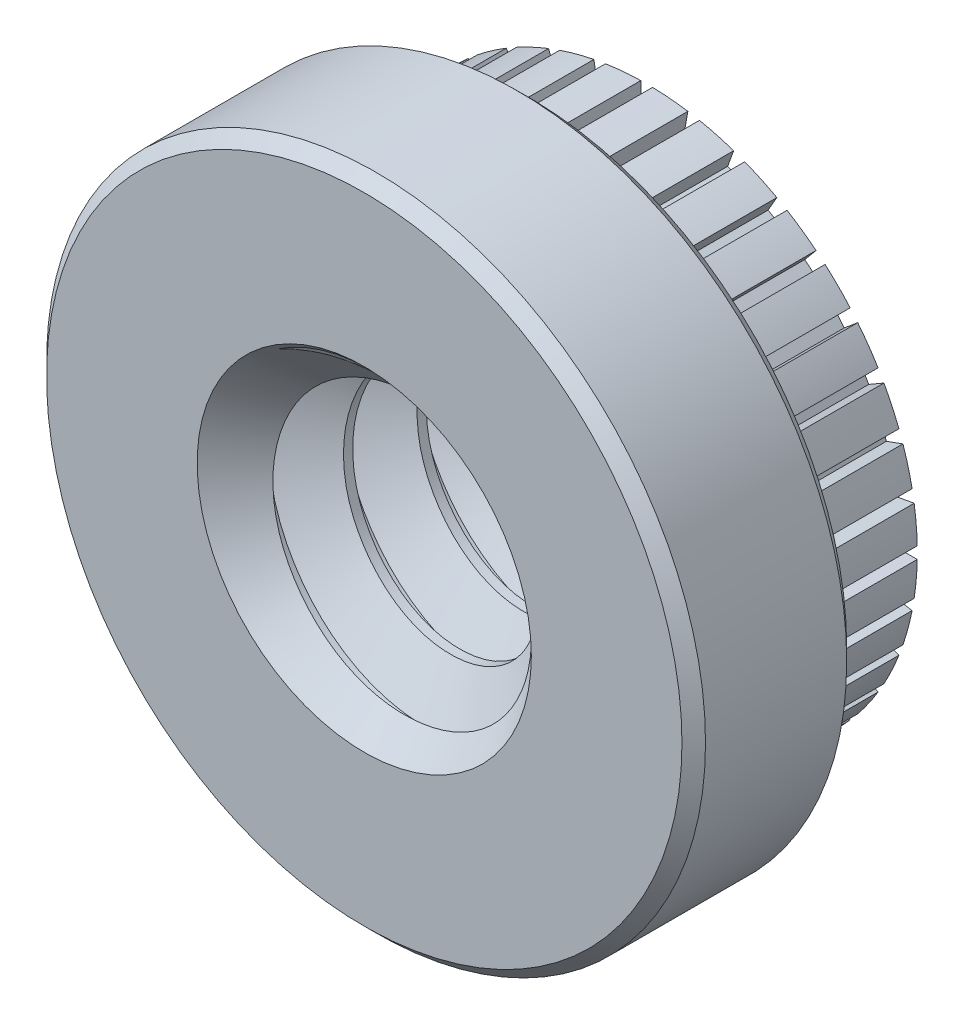
from build123d import *

# Parameters (mm, degrees)
SKETCH1_R               = 3.556
EXTRUDE1_DEPTH          = 1.778
SKETCH2_R               = 2.921
EXTRUDE2_DEPTH          = 1.524
SKETCH3_W               = 0.127
SKETCH3_H               = 0.8255
CUT_EXTRUDE_THIN1_DEPTH = 1.524
CIRPATTERN1_COUNT       = 36
SKETCH5_OUTSIDE_W       = 11.23
SKETCH5_OUTSIDE_H       = 11.23
SKETCH5_OUTSIDE_R       = 2.4765
CUT_EXTRUDE1_DEPTH      = 0.254
CHAMFER1_SIZE           = 0.127
SKETCH6_R               = 3.556
SKETCH6_R_2             = 2.4765
CUT_EXTRUDE2_DEPTH      = 0.127
CHAMFER2_SIZE           = 0.127
SKETCH7_R               = 1.7526
CUT_EXTRUDE3_DEPTH      = 7.016101395
SWEEP1_PITCH            = 0.79375
SKETCH10_R              = 3.429
CUT_EXTRUDE4_DEPTH      = 7.423699814
SKETCH11_R              = 2.3495
CUT_EXTRUDE5_DEPTH      = 7.01610145


with BuildPart() as part:
    # Sketch1 → Extrude1 (new body)
    with BuildSketch(Plane.XY):
        Circle(SKETCH1_R)
    extrude(amount=-EXTRUDE1_DEPTH)

    # Sketch2 → Extrude2 (add)
    with BuildSketch(Plane(origin=(0, 0, -1.778), x_dir=(-1, 0, 0), z_dir=(0, 0, -1))):
        with Locations(Location((0, 0, 0), (0, 0, 180))):
            Circle(SKETCH2_R)
    extrude(amount=EXTRUDE2_DEPTH)

    # Sketch3 → Cut-Extrude-Thin1 (cut)
    with BuildSketch(Plane(origin=(0, 0, -3.302), x_dir=(-1, 0, 0), z_dir=(0, 0, -1))):
        with Locations((0, 3.14325)):
            Rectangle(SKETCH3_W, SKETCH3_H)
    cut_extrude_thin1 = extrude(amount=-CUT_EXTRUDE_THIN1_DEPTH, mode=Mode.SUBTRACT)

    # CirPattern1: Cut-Extrude-Thin1 ×36 about axis
    cirpattern1_axis = Axis((0, 0, 0), (0, 0, 1))
    for i in range(1, CIRPATTERN1_COUNT):
        add(cut_extrude_thin1.rotate(cirpattern1_axis, i * 360 / CIRPATTERN1_COUNT), mode=Mode.SUBTRACT)

    # Sketch5 outside → Cut-Extrude1 (cut)
    with BuildSketch(Plane(origin=(0, 0, -3.302), x_dir=(-1, 0, 0), z_dir=(0, 0, -1))):
        Rectangle(SKETCH5_OUTSIDE_W, SKETCH5_OUTSIDE_H)
        Circle(SKETCH5_OUTSIDE_R, mode=Mode.SUBTRACT)
    extrude(amount=-CUT_EXTRUDE1_DEPTH, mode=Mode.SUBTRACT)

    # Chamfer1
    chamfer1_edges = [part.edges().sort_by_distance(p)[0] for p in [
        (2.4765, 0, -3.302),
    ]]
    chamfer(chamfer1_edges, length=CHAMFER1_SIZE)

    # Sketch6 → Cut-Extrude2 (cut)
    with BuildSketch(Plane(origin=(0, 0, -1.778), x_dir=(-1, 0, 0), z_dir=(0, 0, -1))):
        with Locations(Location((0, 0, 0), (0, 0, 180))):
            Circle(SKETCH6_R)
        Circle(SKETCH6_R_2, mode=Mode.SUBTRACT)
    extrude(amount=CUT_EXTRUDE2_DEPTH, mode=Mode.SUBTRACT)

    # Chamfer2
    chamfer2_edges = [part.edges().sort_by_distance(p)[0] for p in [
        (-3.556, 0, 0),
        (-3.556, 0, -1.778),
    ]]
    chamfer(chamfer2_edges, length=CHAMFER2_SIZE)

    # Sketch7 → Cut-Extrude3 (cut, through all)
    with BuildSketch(Plane.XY):
        Circle(SKETCH7_R)
    extrude(amount=-CUT_EXTRUDE3_DEPTH, mode=Mode.SUBTRACT)

    # Sweep1: the profile of Sketch9 profile screwed along a right-hand helix of 6.24 turns, 6 arcs to a turn; built about Z, then put on its axis
    sweep1_z = Axis((0, 0, 0), (0, 0, 1))
    sweep1_corners = [(1.7529, 0, -0.694704455), (1.237044252, 0, -0.396875), (1.237044252, 0, -0.29765625), (1.7529, 0, 0.000173205)]
    with BuildLine(mode=Mode.PRIVATE) as sweep1_profile:
        Line(sweep1_corners[0], sweep1_corners[1])
        Line(sweep1_corners[1], sweep1_corners[2])
        Line(sweep1_corners[2], sweep1_corners[3])
        Line(sweep1_corners[3], sweep1_corners[0])
    sweep1_cap = Face(sweep1_profile.wire())
    sweep1_turn_angles = [0, 30, 60, 90, 120, 150, 180, 210, 240, 270, 300, 330, 360]
    sweep1_turn_weights = [1, 0.8660254037844387, 1, 0.8660254037844387, 1, 0.8660254037844387, 1, 0.8660254037844387, 1, 0.8660254037844387, 1, 0.8660254037844387, 1]
    sweep1_turn_rails = [Edge.make_bspline([Vector(p[0], p[1], 0).rotate(sweep1_z, sweep1_turn_angles[k]) / sweep1_turn_weights[k] + Vector(0, 0, p[2] + SWEEP1_PITCH * sweep1_turn_angles[k] / 360) for k in range(13)], [0, 0, 0, 1, 1, 2, 2, 3, 3, 4, 4, 5, 5, 6, 6, 6], 2, sweep1_turn_weights) for p in sweep1_corners]
    sweep1_turn_sides = [Face.make_surface_from_curves(sweep1_turn_rails[p[0]], sweep1_turn_rails[p[1]]) for p in [(0, 1), (1, 2), (2, 3), (3, 0)]]
    sweep1_last_angles = [2160, 2190, 2220, 2233.2, 2246.4]
    sweep1_last_weights = [1, 0.8660254037844387, 1, 0.9735789028731501, 1]
    sweep1_last_rails = [Edge.make_bspline([Vector(p[0], p[1], 0).rotate(sweep1_z, sweep1_last_angles[k]) / sweep1_last_weights[k] + Vector(0, 0, p[2] + SWEEP1_PITCH * sweep1_last_angles[k] / 360) for k in range(5)], [0, 0, 0, 1, 1, 2, 2, 2], 2, sweep1_last_weights) for p in sweep1_corners]
    sweep1_last_sides = [Face.make_surface_from_curves(sweep1_last_rails[p[0]], sweep1_last_rails[p[1]]) for p in [(0, 1), (1, 2), (2, 3), (3, 0)]]
    sweep1 = Plane(origin=(0, 0, -3.302), x_dir=(0, 1, 0), z_dir=(0, 0, 1)) * Solid(Shell([*[p.moved(Location((0, 0, SWEEP1_PITCH * i))) for i in range(6) for p in sweep1_turn_sides], *sweep1_last_sides, sweep1_cap, sweep1_cap.rotate(sweep1_z, 2246.4).moved(Location((0, 0, SWEEP1_PITCH * 2246.4 / 360)))]))
    add(sweep1)

    # Sketch10 → Cut-Extrude4 (cut, through all)
    with BuildSketch(Plane.XY):
        Circle(SKETCH10_R)
    extrude(amount=CUT_EXTRUDE4_DEPTH, mode=Mode.SUBTRACT)

    # Sketch11 → Cut-Extrude5 (cut, through all)
    with BuildSketch(Plane(origin=(0, 0, -3.302), x_dir=(-1, 0, 0), z_dir=(0, 0, -1))):
        Circle(SKETCH11_R)
    extrude(amount=CUT_EXTRUDE5_DEPTH, mode=Mode.SUBTRACT)

    # Cut-Extrude6 cone 1 section (through the dimple's axis) → Cut-Extrude6 (revolve, cut)
    with BuildSketch(Plane(origin=(0, 0, 0), x_dir=(0, -1, 0), z_dir=(1, 0, 0))):
        Polygon((0, 0), (1.8034, 0), (0, 1.8034), align=None)
    revolve(axis=Axis((0, 0, 0), (0, 0, -1)), mode=Mode.SUBTRACT)

    # Cut-Extrude7 cone 1 section (through the dimple's axis) → Cut-Extrude7 (revolve, cut)
    with BuildSketch(Plane(origin=(0, 0, -3.302), x_dir=(0, 1, 0), z_dir=(1, 0, 0))):
        Polygon((0, 0), (1.8034, 0), (0, 1.8034), align=None)
    revolve(axis=Axis((0, 0, -3.302), (0, 0, 1)), mode=Mode.SUBTRACT)


solid = part.part
